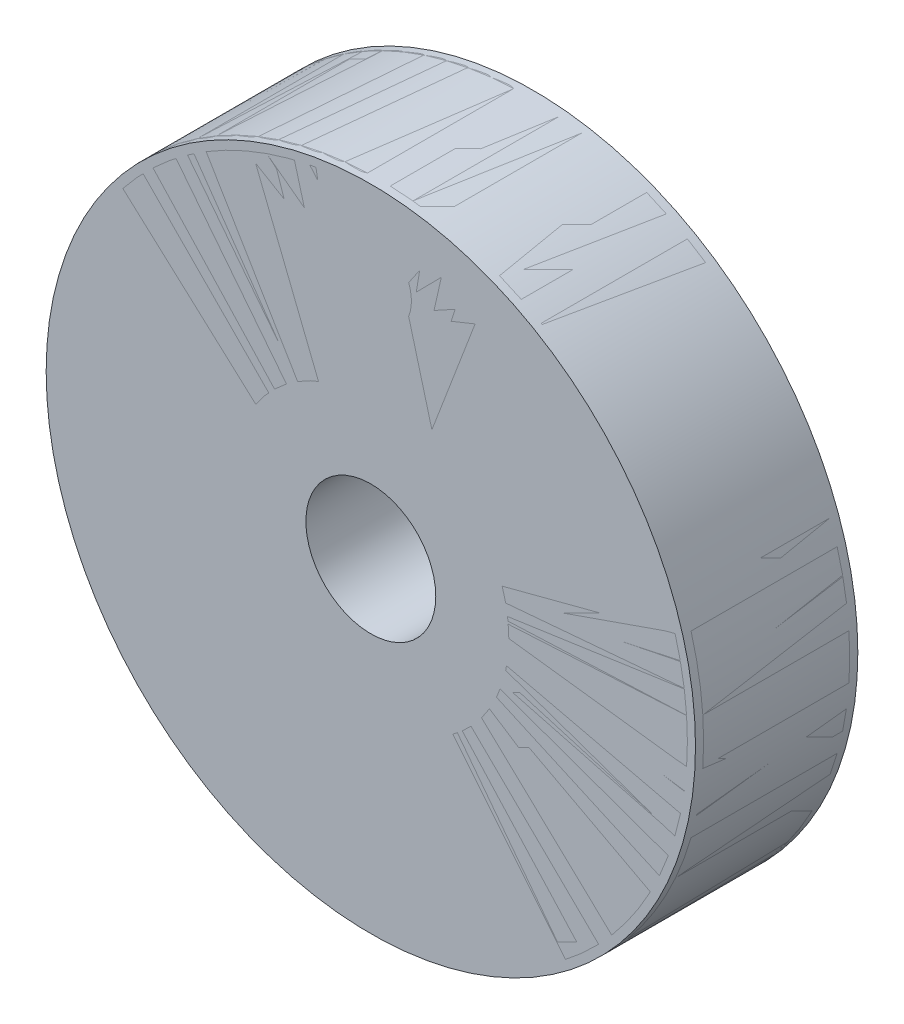
from build123d import *

# Parameters (mm, degrees)
SKETCH_1_R          = 20
EXTRUDE_1_DEPTH     = 10
SKETCH_2_R          = 4
CUT_EXTRUDE_1_DEPTH = 14
SKETCH_3_R          = 8
CUT_EXTRUDE_2_DEPTH = 4
SKETCH_4_R          = 20
EXTRUDE_2_DEPTH     = 10
CUT_EXTRUDE_START   = -10
SKETCH_5_R          = 4
CUT_EXTRUDE_3_DEPTH = 10
CUT_EXTRUDE_START_2 = -4
SKETCH_6_R          = 8
CUT_EXTRUDE_4_DEPTH = 4
SKETCH_7_R          = 2
CUT_EXTRUDE_5_DEPTH = 10
FILLET_1_R          = 0.5
CHAMFER_1_SIZE      = 0.5
FILLET_2_R          = 0.5
CHAMFER_3_SIZE      = 0.5


with BuildPart() as part:
    # 草图1 → 凸台-拉伸1 (new body)
    with BuildSketch(Plane.XY):
        Circle(SKETCH_1_R)
    extrude(amount=EXTRUDE_1_DEPTH)

    # 草图2 → 切除-拉伸1 (cut)
    with BuildSketch(Plane.XY):
        Circle(SKETCH_2_R)
    extrude(amount=CUT_EXTRUDE_1_DEPTH, mode=Mode.SUBTRACT)

    # 草图3 → 切除-拉伸2 (cut)
    with BuildSketch(Plane.XY):
        Circle(SKETCH_3_R)
    extrude(amount=CUT_EXTRUDE_2_DEPTH, mode=Mode.SUBTRACT)


with BuildPart() as body_2:
    # 草图4 → 凸台-拉伸2 (new body)
    with BuildSketch(Plane.XY):
        Circle(SKETCH_4_R)
    extrude(amount=EXTRUDE_2_DEPTH)

    # 草图5 → 切除-拉伸3 (cut)
    with BuildSketch(Plane.XY.offset(10).offset(CUT_EXTRUDE_START)):
        Circle(SKETCH_5_R)
    extrude(amount=CUT_EXTRUDE_3_DEPTH, mode=Mode.SUBTRACT)

    # 草图6 → 切除-拉伸4 (cut)
    with BuildSketch(Plane.XY.offset(10).offset(CUT_EXTRUDE_START_2)):
        Circle(SKETCH_6_R)
    extrude(amount=CUT_EXTRUDE_4_DEPTH, mode=Mode.SUBTRACT)

    # 草图7 → 切除-拉伸5 (cut)
    with BuildSketch(Plane.XY.offset(10)):
        with Locations((0, -14.998800891)):
            Circle(SKETCH_7_R)
        with Locations((0, 15)):
            Circle(SKETCH_7_R)
    extrude(amount=-CUT_EXTRUDE_5_DEPTH, mode=Mode.SUBTRACT)

    # 圆角1
    fillet_1_edges = [body_2.edges().sort_by_distance(p)[0] for p in [
        (-20, 0, 0),
        (-20, 0, 10),
    ]]
    fillet(fillet_1_edges, radius=FILLET_1_R)

    # 倒角1
    chamfer_1_edges = [body_2.edges().sort_by_distance(p)[0] for p in [
        (-8, 0, 10),
    ]]
    chamfer(chamfer_1_edges, length=CHAMFER_1_SIZE)

    # 圆角2
    fillet_2_edges = [body_2.edges().sort_by_distance(p)[0] for p in [
        (-4, 0, 0),
    ]]
    fillet(fillet_2_edges, radius=FILLET_2_R)

    # 倒角3
    chamfer_3_edges = [body_2.edges().sort_by_distance(p)[0] for p in [
        (-2, -14.998800891, 0),
        (-2, -14.998800891, 10),
        (-2, 15, 0),
        (-2, 15, 10),
    ]]
    chamfer(chamfer_3_edges, length=CHAMFER_3_SIZE)


solid = Compound([part.part, body_2.part])
